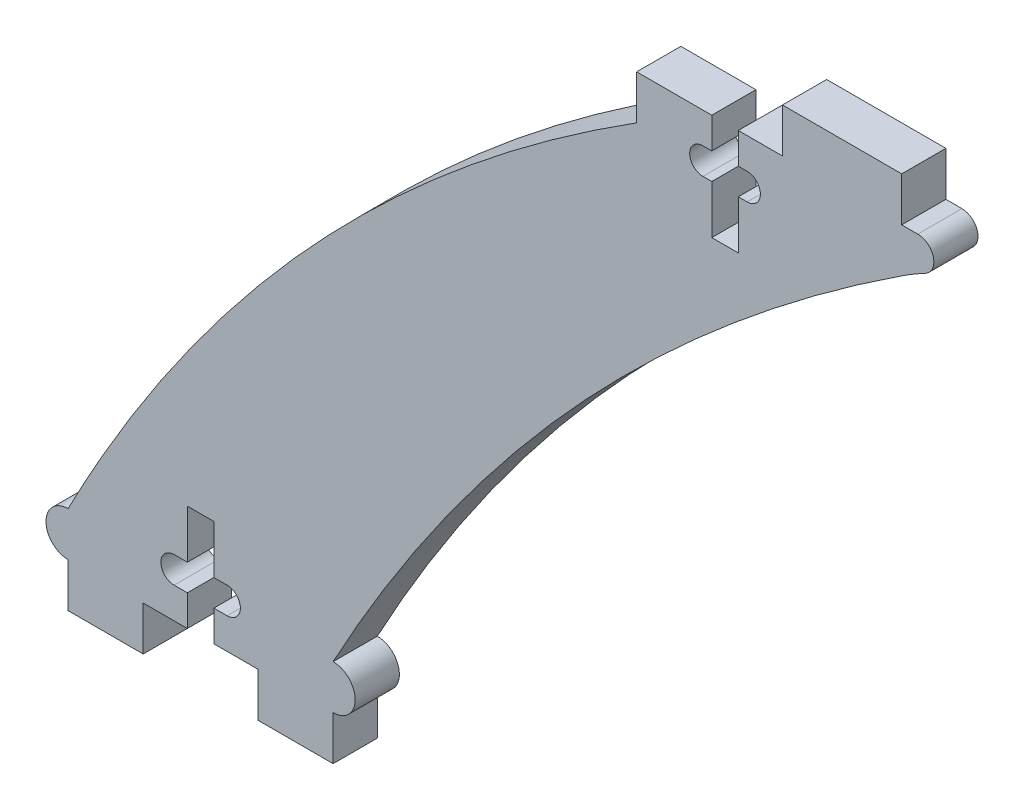
from build123d import *

# Parameters (mm, degrees)
BOSS_EXTRUDE1_DEPTH = 5
SKETCH3_OUTSIDE_W   = 121.122
SKETCH3_OUTSIDE_H   = 106.762
CUT_EXTRUDE1_DEPTH  = 10
SKETCH4_W           = 13.5
SKETCH4_H           = 5
SKETCH4_W_2         = 8.5
SKETCH4_R           = 2.5
BOSS_EXTRUDE2_DEPTH = 5


with BuildPart() as part:
    # Sketch1 → Boss-Extrude1 (new body)
    with BuildSketch(Plane.XY):
        with BuildLine():
            Line((30, 0), (30, 5))
            add(Edge.make_bspline(
                [(94.36042114, 75), (53.195461928, 48.027295895), (30, 5)],
                knots=[0, 0, 0, 1, 1, 1], degree=2))
            Line((94.36042114, 75), (94.36042114, 80))
            Line((94.36042114, 80), (64.36042114, 80))
            Line((64.36042114, 80), (64.36042114, 75))
            add(Edge.make_bspline(
                [(64.36042114, 75), (22.658434304, 48.707086793), (0, 5)],
                knots=[0, 0, 0, 1, 1, 1], degree=2))
            Line((0, 5), (0, 0))
            Line((0, 0), (30, 0))
        make_face()
    extrude(amount=BOSS_EXTRUDE1_DEPTH)

    # Sketch3 outside → Cut-Extrude1 (cut)
    with BuildSketch(Plane.XY.offset(5)):
        with Locations((47.18, 40)):
            Rectangle(SKETCH3_OUTSIDE_W, SKETCH3_OUTSIDE_H)
        with BuildLine():
            Line((72.86042114, 76.5), (72.86042114, 80))
            Line((72.86042114, 80), (64.36042114, 80))
            Line((64.36042114, 80), (64.36042114, 75))
            add(Edge.make_bspline(
                [(64.36042114, 75), (22.658434304, 48.707086793), (0, 5)],
                knots=[0, 0, 0, 1, 1, 1], degree=2))
            Line((0, 5), (0, 0))
            Line((0, 0), (13.5, 0))
            Line((13.5, 0), (13.5, 3.5))
            Line((13.5, 3.5), (12, 3.5))
            ThreePointArc((12, 3.5), (10.5, 5), (12, 6.5))
            Line((12, 6.5), (13.5, 6.5))
            Line((13.5, 6.5), (13.5, 12))
            Line((13.5, 12), (16.5, 12))
            Line((16.5, 12), (16.5, 6.5))
            Line((16.5, 6.5), (18, 6.5))
            ThreePointArc((18, 6.5), (19.5, 5), (18, 3.5))
            Line((18, 3.5), (16.5, 3.5))
            Line((16.5, 3.5), (16.5, 0))
            Line((16.5, 0), (30, 0))
            Line((30, 0), (30, 5))
            add(Edge.make_bspline(
                [(30, 5), (53.195461928, 48.027295895), (94.36042114, 75)],
                knots=[0, 0, 0, 1, 1, 1], degree=2))
            Line((94.36042114, 75), (94.36042114, 80))
            Line((94.36042114, 80), (75.86042114, 80))
            Line((75.86042114, 80), (75.86042114, 76.5))
            Line((75.86042114, 76.5), (76.86042114, 76.5))
            ThreePointArc((76.86042114, 76.5), (78.36042114, 75), (76.86042114, 73.5))
            Line((76.86042114, 73.5), (75.86042114, 73.5))
            Line((75.86042114, 73.5), (75.86042114, 68))
            Line((75.86042114, 68), (72.86042114, 68))
            Line((72.86042114, 68), (72.86042114, 73.5))
            Line((72.86042114, 73.5), (71.86042114, 73.5))
            ThreePointArc((71.86042114, 73.5), (70.36042114, 75), (71.86042114, 76.5))
            Line((71.86042114, 76.5), (72.86042114, 76.5))
        make_face(mode=Mode.SUBTRACT)
    extrude(amount=-CUT_EXTRUDE1_DEPTH, mode=Mode.SUBTRACT)

    # Sketch4 → Boss-Extrude2 (add)
    with BuildSketch(Plane.XY.offset(5)):
        with Locations((87.61042114, 82.5)):
            Rectangle(SKETCH4_W, SKETCH4_H)
        with BuildLine():
            Line((96.177410551, 80), (94.36042114, 80))
            Line((94.36042114, 80), (94.36042114, 75))
            ThreePointArc((94.36042114, 75), (95.670266462, 75.821056521), (97.020667914, 76.573548711))
            ThreePointArc((97.020667914, 76.573548711), (97.941755431, 78.617219829), (96.177410551, 80))
        make_face()
        with Locations((4.25, -2.5)):
            Rectangle(SKETCH4_W_2, SKETCH4_H)
        with Locations((0, 2.5)):
            Circle(SKETCH4_R)
        with Locations((25.75, -2.5)):
            Rectangle(SKETCH4_W_2, SKETCH4_H)
        with Locations((30, 2.5)):
            Circle(SKETCH4_R)
    extrude(amount=-BOSS_EXTRUDE2_DEPTH)


solid = part.part
